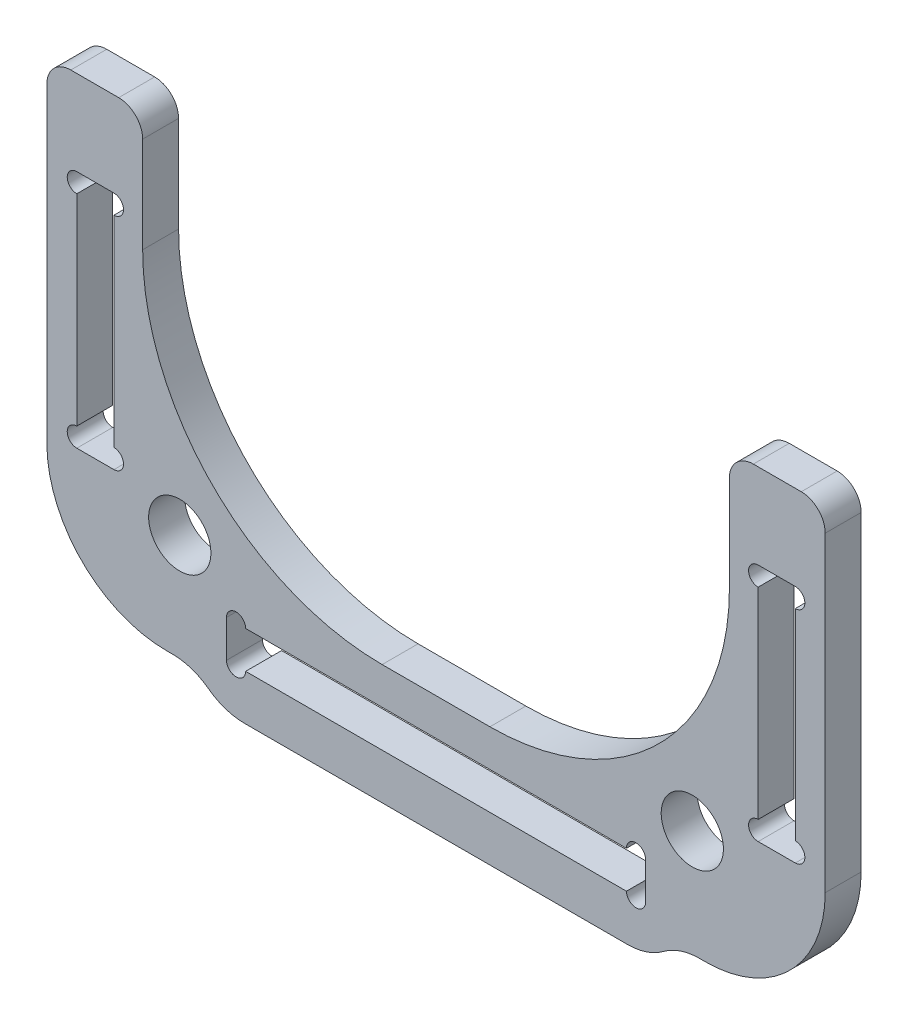
from build123d import *

# Parameters (mm, degrees)
BOSS_EXTRUDE1_DEPTH = 3
FILLET1_R           = 20
CUT_EXTRUDE1_DEPTH  = 51.092414595
SKETCH3_R           = 2.6
CUT_EXTRUDE2_DEPTH  = 51.092414595
FILLET2_R           = 10
FILLET3_R           = 2
SKETCH4_W           = 36
SKETCH4_H           = 2
BOSS_EXTRUDE2_DEPTH = 3
FILLET4_R           = 5
FILLET5_R           = 5


with BuildPart() as part:
    # Sketch1 → Boss-Extrude1 (new body)
    with BuildSketch(Plane.XY):
        Polygon((0, 0), (-32.5, 0), (-32.5, 38), (-24.5, 38), (-24.5, 8), (0, 8), (24.5, 8), (24.5, 38), (32.5, 38), (32.5, 0), align=None)
    extrude(amount=BOSS_EXTRUDE1_DEPTH)

    # Fillet1
    fillet1_edges = [part.edges().sort_by_distance(p)[0] for p in [
        (24.5, 8, 1.5),
        (-24.5, 8, 1.5),
    ]]
    fillet(fillet1_edges, radius=FILLET1_R)

    # Sketch2 → Cut-Extrude1 (cut, through all)
    with BuildSketch(Plane.XY.offset(3)):
        with BuildLine():
            Line((-30, 10.9), (-26.9, 10.9))
            ThreePointArc((-26.9, 10.9), (-26.1, 11.7), (-26.9, 12.5))
            Line((-26.9, 12.5), (-26.9, 29.3))
            ThreePointArc((-26.9, 29.3), (-26.1, 30.1), (-26.9, 30.9))
            Line((-26.9, 30.9), (-30, 30.9))
            ThreePointArc((-30, 30.9), (-30.8, 30.1), (-30, 29.3))
            Line((-30, 29.3), (-30, 12.5))
            ThreePointArc((-30, 12.5), (-30.8, 11.7), (-30, 10.9))
        make_face()
        with BuildLine():
            Line((26.9, 12.5), (26.9, 29.3))
            ThreePointArc((26.9, 29.3), (26.1, 30.1), (26.9, 30.9))
            Line((26.9, 30.9), (30, 30.9))
            ThreePointArc((30, 30.9), (30.8, 30.1), (30, 29.3))
            Line((30, 29.3), (30, 12.5))
            ThreePointArc((30, 12.5), (30.8, 11.7), (30, 10.9))
            Line((30, 10.9), (26.9, 10.9))
            ThreePointArc((26.9, 10.9), (26.1, 11.7), (26.9, 12.5))
        make_face()
        with BuildLine():
            Line((-15.9, 1.81), (15.9, 1.81))
            ThreePointArc((15.9, 1.81), (16.7, 1.01), (17.5, 1.81))
            Line((17.5, 1.81), (17.5, 4.91))
            ThreePointArc((17.5, 4.91), (16.7, 5.71), (15.9, 4.91))
            Line((15.9, 4.91), (-15.9, 4.91))
            ThreePointArc((-15.9, 4.91), (-16.7, 5.71), (-17.5, 4.91))
            Line((-17.5, 4.91), (-17.5, 1.81))
            ThreePointArc((-17.5, 1.81), (-16.7, 1.01), (-15.9, 1.81))
        make_face()
    extrude(amount=-CUT_EXTRUDE1_DEPTH, mode=Mode.SUBTRACT)

    # Sketch3 → Cut-Extrude2 (cut, through all)
    with BuildSketch(Plane.XY.offset(3)):
        with Locations((-21.4, 8.91)):
            Circle(SKETCH3_R)
        with Locations(Location((21.4, 8.91, 0), (0, 0, 180))):
            Circle(SKETCH3_R)
    extrude(amount=-CUT_EXTRUDE2_DEPTH, mode=Mode.SUBTRACT)

    # Fillet2
    fillet2_edges = [part.edges().sort_by_distance(p)[0] for p in [
        (32.5, 0, 1.5),
        (-32.5, 0, 1.5),
    ]]
    fillet(fillet2_edges, radius=FILLET2_R)

    # Fillet3
    fillet3_edges = [part.edges().sort_by_distance(p)[0] for p in [
        (24.5, 38, 1.5),
        (32.5, 38, 1.5),
        (-32.5, 38, 1.5),
        (-24.5, 38, 1.5),
    ]]
    fillet(fillet3_edges, radius=FILLET3_R)

    # Sketch4 → Boss-Extrude2 (add)
    with BuildSketch(Plane.XY.offset(3)):
        with Locations((0, -1)):
            Rectangle(SKETCH4_W, SKETCH4_H)
    extrude(amount=-BOSS_EXTRUDE2_DEPTH)

    # Fillet4
    # the kernel refuses this fillet: 5 mm, written as the material it adds along each edge
    with BuildSketch(Plane(origin=(-18, 0, 3), x_dir=(-1, 0, 0), z_dir=(0, 0, -1))) as fillet4_piece_1:
        with BuildLine():
            CenterArc((4, -5), FILLET4_R, 90, 53.130102354)
            Line((0, -2), (0, 0))
            Line((0, 0), (4, 0))
        make_face()
    extrude(amount=3)
    with BuildSketch(Plane(origin=(18, 0, 3), x_dir=(1, 0, 0), z_dir=(0, 0, -1))) as fillet4_piece_2:
        with BuildLine():
            CenterArc((4, 5), FILLET4_R, 216.869897646, 53.130102354)
            Line((0, 2), (0, 0))
            Line((0, 0), (4, 0))
        make_face()
    extrude(amount=3)

    # Fillet5
    fillet5_edges = [part.edges().sort_by_distance(p)[0] for p in [
        (-18, -2, 1.5),
        (18, -2, 1.5),
    ]]
    fillet(fillet5_edges, radius=FILLET5_R)


solid = part.part
